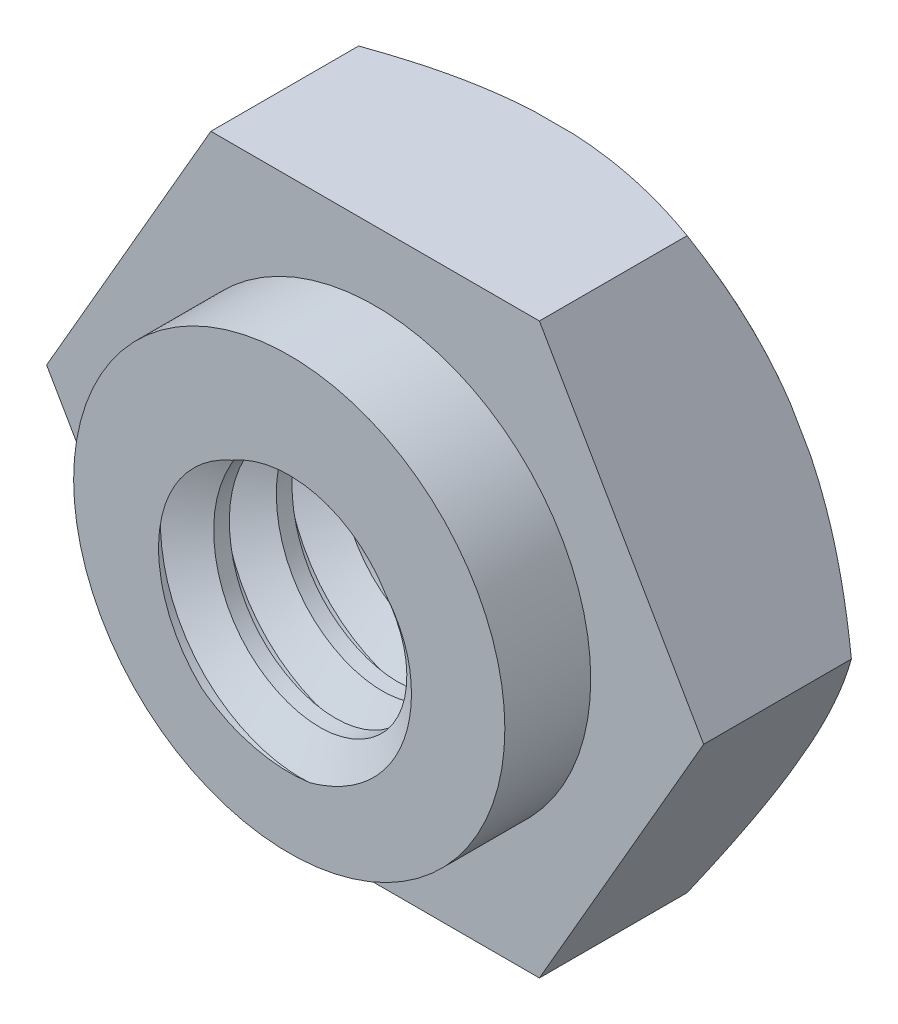
from build123d import *

# Parameters (mm, degrees)
BOSS_EXTRUDE1_DEPTH      = 1
SKETCH2_R                = 1.205
BOSS_EXTRUDE2_DEPTH      = 0.48
M1_6X0_35_TAPPED_HOLE1_D = 1.25
THREAD1_PITCH            = 0.35


with BuildPart() as part:
    # Sketch1 → Boss-Extrude1 (new body)
    with BuildSketch(Plane.XY):
        Polygon((-0.917986928, -1.59), (0.917986928, -1.59), (1.835973856, 0), (0.917986928, 1.59), (-0.917986928, 1.59), (-1.835973856, 0), align=None)
    extrude(amount=BOSS_EXTRUDE1_DEPTH)

    # Sketch2 → Boss-Extrude2 (add)
    with BuildSketch(Plane.XY.offset(1)):
        Circle(SKETCH2_R)
    extrude(amount=BOSS_EXTRUDE2_DEPTH)

    # Sketch3 → Cut-Revolve1 (revolve, cut)
    with BuildSketch(Plane(origin=(0, 0, 0), x_dir=(-1, 0, 0), z_dir=(0, -1, 0))):
        Polygon((1.593912359, 0), (1.835973856, -0.174372028), (1.835973856, 0), align=None)
    revolve(axis=Axis((0, 0, 1.48), (0, 0, -1)), mode=Mode.SUBTRACT)

    # M1.6x0.35 Tapped Hole1 (through all)
    with Locations(Plane(origin=(0, 0, 0), x_dir=(-1, 0, 0), z_dir=(0, 0, -1))):
        with Locations((0, 0)):
            Hole(M1_6X0_35_TAPPED_HOLE1_D / 2)

    # Thread1: the profile of Thread Profile1 profile screwed along a right-hand helix of 28.571429 turns, 6 arcs to a turn; built about Z, then put on its axis
    thread1_z = Axis((0, 0, 0), (0, 0, 1))
    thread1_corners = [(0.6247, 0, -0.000173205), (0.814443056, 0, 0.109375), (0.814443056, 0, 0.153125), (0.6247, 0, 0.262673204)]
    with BuildLine(mode=Mode.PRIVATE) as thread1_profile:
        Line(thread1_corners[0], thread1_corners[1])
        Line(thread1_corners[1], thread1_corners[2])
        Line(thread1_corners[2], thread1_corners[3])
        Line(thread1_corners[3], thread1_corners[0])
    thread1_cap = Face(thread1_profile.wire())
    thread1_turn_angles = [0, 30, 60, 90, 120, 150, 180, 210, 240, 270, 300, 330, 360]
    thread1_turn_weights = [1, 0.8660254037844387, 1, 0.8660254037844387, 1, 0.8660254037844387, 1, 0.8660254037844387, 1, 0.8660254037844387, 1, 0.8660254037844387, 1]
    thread1_turn_rails = [Edge.make_bspline([Vector(p[0], p[1], 0).rotate(thread1_z, thread1_turn_angles[k]) / thread1_turn_weights[k] + Vector(0, 0, p[2] + THREAD1_PITCH * thread1_turn_angles[k] / 360) for k in range(13)], [0, 0, 0, 1, 1, 2, 2, 3, 3, 4, 4, 5, 5, 6, 6, 6], 2, thread1_turn_weights) for p in thread1_corners]
    thread1_turn_sides = [Face.make_surface_from_curves(thread1_turn_rails[p[0]], thread1_turn_rails[p[1]]) for p in [(0, 1), (1, 2), (2, 3), (3, 0)]]
    thread1_last_angles = [10080, 10110, 10140, 10170, 10200, 10230, 10260, 10272.857142857, 10285.714285714]
    thread1_last_weights = [1, 0.8660254037844387, 1, 0.8660254037844387, 1, 0.8660254037844387, 1, 0.9749279121818226, 1]
    thread1_last_rails = [Edge.make_bspline([Vector(p[0], p[1], 0).rotate(thread1_z, thread1_last_angles[k]) / thread1_last_weights[k] + Vector(0, 0, p[2] + THREAD1_PITCH * thread1_last_angles[k] / 360) for k in range(9)], [0, 0, 0, 1, 1, 2, 2, 3, 3, 4, 4, 4], 2, thread1_last_weights) for p in thread1_corners]
    thread1_last_sides = [Face.make_surface_from_curves(thread1_last_rails[p[0]], thread1_last_rails[p[1]]) for p in [(0, 1), (1, 2), (2, 3), (3, 0)]]
    thread1 = Plane(origin=(0, 0, -1), x_dir=(1, 0, 0), z_dir=(0, 0, 1)) * Solid(Shell([*[p.moved(Location((0, 0, THREAD1_PITCH * i))) for i in range(28) for p in thread1_turn_sides], *thread1_last_sides, thread1_cap, thread1_cap.rotate(thread1_z, 10285.714285714).moved(Location((0, 0, THREAD1_PITCH * 10285.714285714 / 360)))]))
    add(thread1, mode=Mode.SUBTRACT)


solid = part.part
